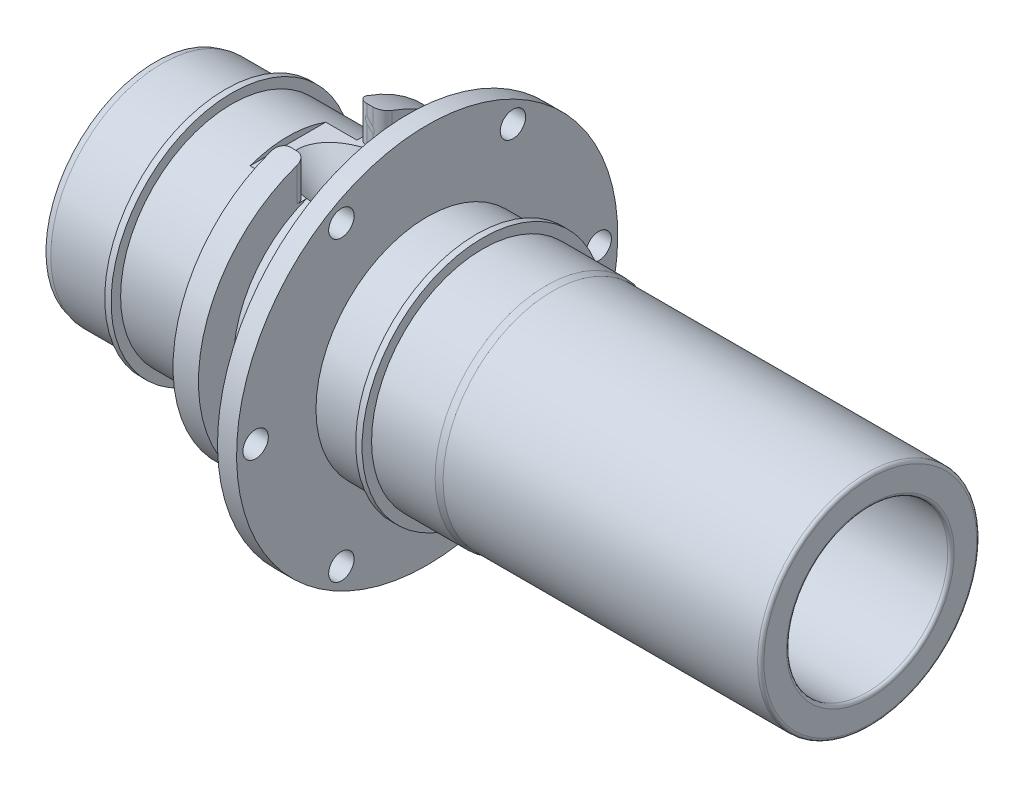
from build123d import *
from build123d.topology import SkipClean

# Parameters (mm, degrees)
SKETCH2_R          = 2
CUT_EXTRUDE1_DEPTH = 92.660037639
CUT_EXTRUDE2_DEPTH = 6.025391911


# Read off the part's stored shape, not the designer's step: Cut-Extrude2
with BuildPart() as part:
    # Sketch1 → Revolve1 (revolve)
    with BuildSketch(Plane.XY, mode=Mode.PRIVATE) as revolve1_sk:
        with BuildLine():
            Line((-1.5, 17.5), (6.5, 17.5))
            Line((6.5, 17.5), (6.5, 23))
            Line((6.5, 23), (8.5, 23))
            Line((8.5, 23), (8.5, 30))
            Line((8.5, 30), (11.5, 30))
            Line((11.5, 30), (11.5, 17.5))
            Line((11.5, 17.5), (19.25, 17.5))
            Line((19.25, 17.5), (19.25, 19))
            Line((19.25, 19), (20.25, 19))
            Line((20.25, 19), (20.25, 17.5))
            Line((20.25, 17.5), (30.25, 17.5))
            Line((30.25, 17.5), (31.25, 17.25))
            Line((31.25, 17.25), (80.75, 17.25))
            ThreePointArc((80.75, 17.25), (81.103553391, 17.103553391), (81.25, 16.75))
            Line((81.25, 16.75), (81.25, 13.2))
            ThreePointArc((81.25, 13.2), (81.103553391, 12.846446609), (80.75, 12.7))
            Line((80.75, 12.7), (-31.25, 12.7))
            Line((-31.25, 12.7), (-31.25, 17.25))
            Line((-31.25, 17.25), (-30.25, 17.5))
            Line((-30.25, 17.5), (-20.25, 17.5))
            Line((-20.25, 17.5), (-20.25, 19))
            Line((-20.25, 19), (-19.25, 19))
            Line((-19.25, 19), (-19.25, 17.5))
            Line((-19.25, 17.5), (-5.5, 17.5))
            Line((-5.5, 17.5), (-5.5, 23))
            Line((-5.5, 23), (-1.5, 23))
            Line((-1.5, 23), (-1.5, 17.5))
        make_face()
    revolve(revolve1_sk.sketch.rotate(Axis((-31.25, 0, 0), (1, 0, 0)), 180), axis=Axis((-31.25, 0, 0), (1, 0, 0)))

    # Sketch2 → Cut-Extrude1 (cut, through all)
    with BuildSketch(Plane(origin=(0, 0, 0), x_dir=(0, 0, -1), z_dir=(1, 0, 0))):
        with Locations(Location((27, 0, 0), (0, 0, 270))):
            Circle(SKETCH2_R)
        with Locations(Location((13.5, -23.382685902, 0), (0, 0, 270))):
            Circle(SKETCH2_R)
        with Locations(Location((-13.5, -23.382685902, 0), (0, 0, 270))):
            Circle(SKETCH2_R)
        with Locations(Location((-27, 0, 0), (0, 0, 270))):
            Circle(SKETCH2_R)
        with Locations(Location((-13.5, 23.382685902, 0), (0, 0, 270))):
            Circle(SKETCH2_R)
        with Locations(Location((13.5, 23.382685902, 0), (0, 0, 270))):
            Circle(SKETCH2_R)
    extrude(amount=CUT_EXTRUDE1_DEPTH, mode=Mode.SUBTRACT)

    # Sketch3 → Cut-Revolve1 (revolve, cut)
    with BuildSketch(Plane.XY):
        Polygon((16, 0), (-16.947446606, 32.947446606), (-21.190087293, 28.704805919), (11.757359313, -4.242640687), align=None)
    revolve(axis=Axis((-23.931199794, 39.931199794, 0), (0.7071067811865516, -0.7071067811865436, 0)), mode=Mode.SUBTRACT)

    # Cut-Extrude2 outline → Cut-Extrude2 (cut)
    with SkipClean():  # the faces are left unmerged after this step: merging them gives an invalid solid
        with BuildSketch(Plane(origin=(0, 16.455853693, 0), x_dir=(1, 0, 0), z_dir=(0, 1, 0))):
            with BuildLine():
                Line((-2.992126028, 5.992167254), (-3.992126028, 5.986917867))
                ThreePointArc((-3.992126028, 5.986917867), (-5.057872639, 6.423456803), (-5.5, 7.4868972))
                Line((-5.5, 7.4868972), (-5.5, 11.85382039))
                Line((-5.5, 11.85382039), (-10.416830721, 11.85382039))
                Line((-10.416830721, 11.85382039), (-10.416830721, 5.95439999))
                Line((-10.416830721, 5.95439999), (-10.416830721, -5.95439999))
                Line((-10.416830721, -5.95439999), (-10.416830721, -11.85382039))
                Line((-10.416830721, -11.85382039), (-5.5, -11.85382039))
                Line((-5.5, -11.85382039), (-5.5, -7.4868972))
                ThreePointArc((-5.5, -7.4868972), (-5.057872639, -6.423456803), (-3.992126028, -5.986917867))
                Line((-3.992126028, -5.986917867), (-2.992126028, -5.992167254))
                ThreePointArc((-2.992126028, -5.992167254), (-1.936559603, -6.434273947), (-1.5, -7.492146587))
                Line((-1.5, -7.492146587), (-1.5, -11.85382039))
                Line((-1.5, -11.85382039), (6.5, -11.85382039))
                Line((6.5, -11.85382039), (6.5, 11.85382039))
                Line((6.5, 11.85382039), (-1.5, 11.85382039))
                Line((-1.5, 11.85382039), (-1.5, 7.492146587))
                ThreePointArc((-1.5, 7.492146587), (-1.936559603, 6.434273947), (-2.992126028, 5.992167254))
            make_face()
        extrude(amount=CUT_EXTRUDE2_DEPTH, mode=Mode.SUBTRACT)


solid = part.part
